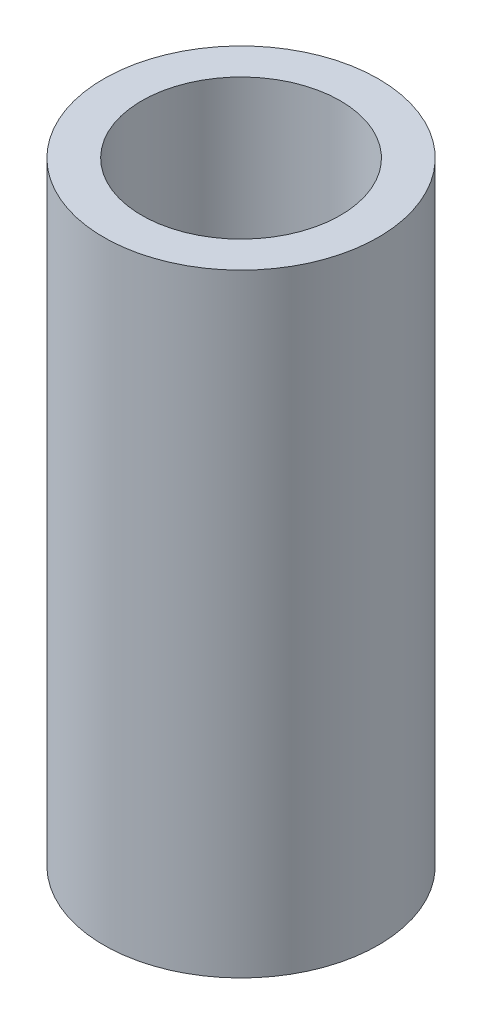
from build123d import *

# Parameters (mm, degrees)
SKETCH1_W = 1.55
SKETCH1_H = 25


with BuildPart() as part:
    # Sketch1 → Revolve1 (revolve)
    with BuildSketch(Plane.XY):
        with Locations((4.825, 12.5)):
            Rectangle(SKETCH1_W, SKETCH1_H)
    revolve(axis=Axis((0, 0, 0), (0, 1, 0)))


solid = part.part
